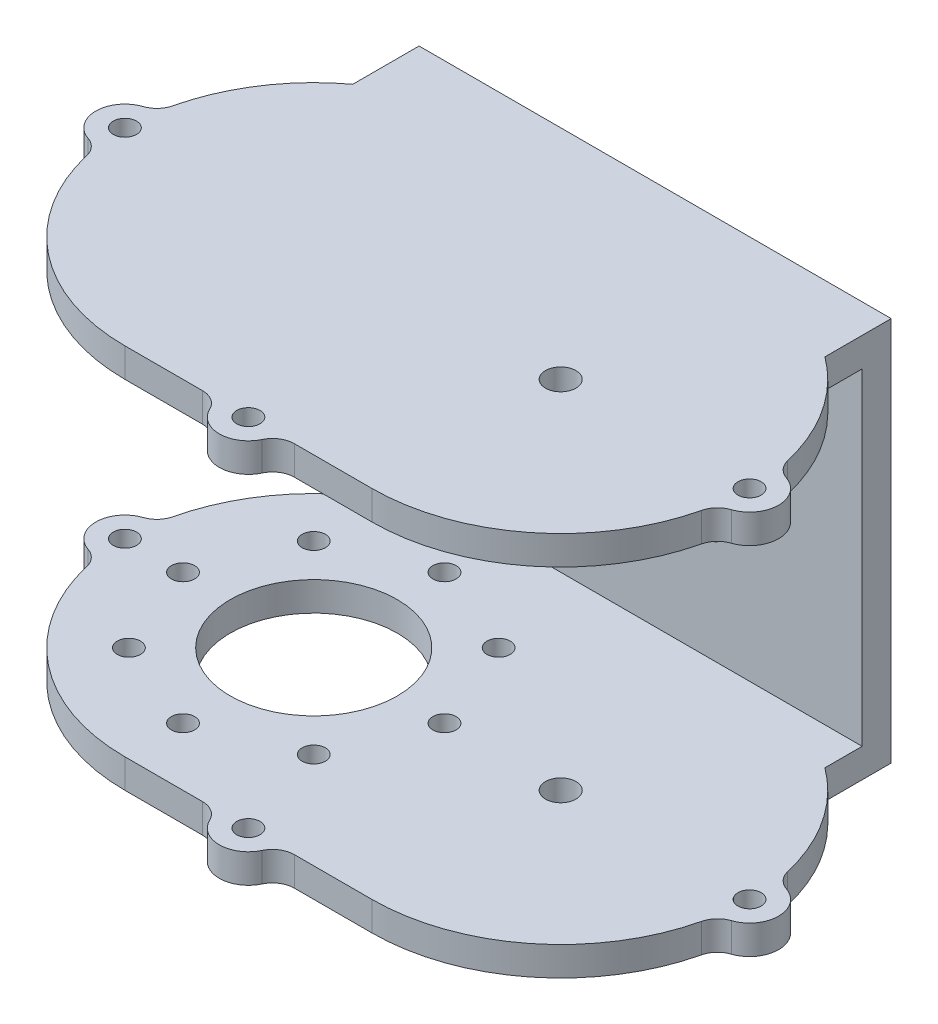
from build123d import *
from build123d.topology import SkipClean

# Parameters (mm, degrees)
SKETCH_1_W          = 65
SKETCH_1_H          = 53
SKETCH_1_R          = 1.6
EXTRUDE_1_DEPTH     = 4
EXTRUDE_2_DEPTH     = 60
SKETCH_5_R          = 1.6
SKETCH_5_R_2        = 11.5
CUT_EXTRUDE_1_DEPTH = 4
CUT_EXTRUDE_2_DEPTH = 69
SKETCH_6_3_R        = 1.6
EXTRUDE_3_DEPTH     = 4
EXTRUDE_START       = -53
EXTRUDE_4_DEPTH     = 4
SKETCH_7_R          = 2.1
CUT_EXTRUDE_3_DEPTH = 100
EXTRUDE_6_DEPTH     = 4
EXTRUDE_START_2     = -49
EXTRUDE_7_DEPTH     = 4
CUT_EXTRUDE_4_DEPTH = 70
FILLET_1_R          = 3


# Read off the part's stored shape, not the designer's step: 凸台-拉伸4
with BuildPart() as part:
    # 草图1 → 凸台-拉伸1 (new body)
    with BuildSketch(Plane.XY):
        Rectangle(SKETCH_1_W, SKETCH_1_H)
        with Locations((0, 13.5)):
            Circle(SKETCH_1_R, mode=Mode.SUBTRACT)
        with Locations((11.691342951, 6.75)):
            Circle(SKETCH_1_R, mode=Mode.SUBTRACT)
        with Locations((11.691342951, -6.75)):
            Circle(SKETCH_1_R, mode=Mode.SUBTRACT)
        with Locations((0, -13.5)):
            Circle(SKETCH_1_R, mode=Mode.SUBTRACT)
        with Locations((-11.691342951, -6.75)):
            Circle(SKETCH_1_R, mode=Mode.SUBTRACT)
        with Locations((-11.691342951, 6.75)):
            Circle(SKETCH_1_R, mode=Mode.SUBTRACT)
    extrude(amount=EXTRUDE_1_DEPTH)

    # 草图3 → 凸台-拉伸2 (add)
    with BuildSketch(Plane.XY.offset(4)):
        Polygon((28.5, 22.5), (-28.5, 22.5), (-32.5, 22.5), (-32.5, 26.5), (32.5, 26.5), (32.5, 22.5), align=None)
        Polygon((-28.5, -22.5), (28.5, -22.5), (32.5, -22.5), (32.5, -26.5), (-32.5, -26.5), (-32.5, -22.5), align=None)
    extrude(amount=EXTRUDE_2_DEPTH)

    # 草图5 → 切除-拉伸1 (cut)
    with BuildSketch(Plane.XZ.offset(26.5)):
        with Locations(Location((-17, 48, 0), (0, 0, 270))):
            Circle(SKETCH_5_R)
        with Locations(Location((-17, 30, 0), (0, 0, 270))):
            Circle(SKETCH_5_R_2)
        with Locations(Location((-4.272077939, 42.727922061, 0), (0, 0, 270))):
            Circle(SKETCH_5_R)
        with Locations(Location((1, 30, 0), (0, 0, 270))):
            Circle(SKETCH_5_R)
        with Locations(Location((-4.272077939, 17.272077939, 0), (0, 0, 270))):
            Circle(SKETCH_5_R)
        with Locations(Location((-17, 12, 0), (0, 0, 270))):
            Circle(SKETCH_5_R)
        with Locations(Location((-29.727922061, 17.272077939, 0), (0, 0, 270))):
            Circle(SKETCH_5_R)
        with Locations((-35, 30)):
            Circle(SKETCH_5_R)
        with Locations(Location((-29.727922061, 42.727922061, 0), (0, 0, 270))):
            Circle(SKETCH_5_R)
    extrude(amount=-CUT_EXTRUDE_1_DEPTH, mode=Mode.SUBTRACT)

    # 草图6 → 切除-拉伸2 (cut)
    with BuildSketch(Plane.XZ.offset(26.5)):
        with BuildLine():
            ThreePointArc((-32.5, 50.874625745), (-25.162711885, 54.685423527), (-17, 56))
            Line((-17, 56), (17, 56))
            ThreePointArc((17, 56), (25.162711885, 54.685423527), (32.5, 50.874625745))
            Line((32.5, 50.874625745), (32.5, 64))
            Line((32.5, 64), (-32.5, 64))
            Line((-32.5, 64), (-32.5, 50.874625745))
        make_face()
    extrude(amount=-CUT_EXTRUDE_2_DEPTH, mode=Mode.SUBTRACT)

    # 草图6<3> → 凸台-拉伸3 (add)
    # profile 1 of 2: a face of its own
    with BuildSketch(Plane.XZ.offset(26.5)):
        with BuildLine():
            Line((-32.5, 9.125374255), (-32.5, 50.874625745))
            ThreePointArc((-32.5, 50.874625745), (-43, 30), (-32.5, 9.125374255))
        make_face()
        with Locations(Location((-35, 30, 0), (0, 0, 270))):
            Circle(SKETCH_6_3_R, mode=Mode.SUBTRACT)
    # profile 2 of 2: a face of its own
    with BuildSketch(Plane.XZ.offset(26.5)):
        with BuildLine():
            ThreePointArc((32.5, 9.125374255), (43, 30), (32.5, 50.874625745))
            Line((32.5, 50.874625745), (32.5, 9.125374255))
        make_face()
    extrude(amount=-EXTRUDE_3_DEPTH)

    # 凸台-拉伸4 outline → 凸台-拉伸4 (add)
    with BuildSketch(Plane.XZ.offset(26.5).offset(EXTRUDE_START)):
        with BuildLine():
            Line((-32.5, 9.125374255), (-32.5, 50.874625745))
            ThreePointArc((-32.5, 50.874625745), (-43, 30), (-32.5, 9.125374255))
        make_face()
        with BuildLine():
            Line((32.5, 50.874625745), (32.5, 9.125374255))
            ThreePointArc((32.5, 9.125374255), (43, 30), (32.5, 50.874625745))
        make_face()
    extrude(amount=EXTRUDE_4_DEPTH)

    # 草图7 → 切除-拉伸3 (cut)
    with BuildSketch(Plane(origin=(0, 26.5, 0), x_dir=(1, 0, 0), z_dir=(0, 1, 0))):
        with Locations(Location((17, -30, 0), (0, 0, 270))):
            Circle(SKETCH_7_R)
    extrude(amount=-CUT_EXTRUDE_3_DEPTH, mode=Mode.SUBTRACT)

    # 草图8 → 凸台-拉伸6 (add)
    with BuildSketch(Plane.XZ.offset(26.5)):
        with BuildLine():
            ThreePointArc((4, 56), (0, 60), (-4, 56))
            Line((-4, 56), (-1.6, 56))
            ThreePointArc((-1.6, 56), (0, 57.6), (1.6, 56))
            Line((1.6, 56), (4, 56))
        make_face()
        with BuildLine():
            ThreePointArc((-42.950769231, 31.599242424), (-42.849150201, 32.796682655), (-42.692307692, 33.988148122))
            ThreePointArc((-42.692307692, 33.988148122), (-47, 30), (-42.692307692, 26.011851878))
            ThreePointArc((-42.692307692, 26.011851878), (-42.849150201, 27.203317345), (-42.950769231, 28.400757576))
            ThreePointArc((-42.950769231, 28.400757576), (-44.6, 30), (-42.950769231, 31.599242424))
        make_face()
        with BuildLine():
            ThreePointArc((42.692307692, 26.011851878), (47, 30), (42.692307692, 33.988148122))
            ThreePointArc((42.692307692, 33.988148122), (42.849150201, 32.796682655), (42.950769231, 31.599242424))
            ThreePointArc((42.950769231, 31.599242424), (44.113829154, 31.148644686), (44.6, 30))
            ThreePointArc((44.6, 30), (44.113829154, 28.851355314), (42.950769231, 28.400757576))
            ThreePointArc((42.950769231, 28.400757576), (42.849150201, 27.203317345), (42.692307692, 26.011851878))
        make_face()
    extrude(amount=-EXTRUDE_6_DEPTH)

    # 草图8<4> → 凸台-拉伸7 (add)
    with BuildSketch(Plane.XZ.offset(26.5).offset(EXTRUDE_START_2)):
        with BuildLine():
            ThreePointArc((4, 56), (0, 60), (-4, 56))
            Line((-4, 56), (-1.6, 56))
            ThreePointArc((-1.6, 56), (0, 57.6), (1.6, 56))
            Line((1.6, 56), (4, 56))
        make_face()
        with BuildLine():
            ThreePointArc((42.692307692, 26.011851878), (47, 30), (42.692307692, 33.988148122))
            ThreePointArc((42.692307692, 33.988148122), (42.849150201, 32.796682655), (42.950769231, 31.599242424))
            ThreePointArc((42.950769231, 31.599242424), (44.113829154, 31.148644686), (44.6, 30))
            ThreePointArc((44.6, 30), (44.113829154, 28.851355314), (42.950769231, 28.400757576))
            ThreePointArc((42.950769231, 28.400757576), (42.849150201, 27.203317345), (42.692307692, 26.011851878))
        make_face()
        with BuildLine():
            ThreePointArc((-42.950769231, 31.599242424), (-42.849150201, 32.796682655), (-42.692307692, 33.988148122))
            ThreePointArc((-42.692307692, 33.988148122), (-47, 30), (-42.692307692, 26.011851878))
            ThreePointArc((-42.692307692, 26.011851878), (-42.849150201, 27.203317345), (-42.950769231, 28.400757576))
            ThreePointArc((-42.950769231, 28.400757576), (-44.6, 30), (-42.950769231, 31.599242424))
        make_face()
    extrude(amount=-EXTRUDE_7_DEPTH)

    # 草图8<5> → 切除-拉伸4 (cut)
    with SkipClean():  # the faces are left unmerged after this step: merging them gives an invalid solid
        with BuildSketch(Plane.XZ.offset(26.5)):
            with BuildLine():
                Line((0, 56), (-1.6, 56))
                ThreePointArc((-1.6, 56), (-1.13137085, 54.86862915), (0, 54.4))
                Line((0, 54.4), (0, 56))
            make_face()
            with BuildLine():
                ThreePointArc((0, 54.4), (1.13137085, 54.86862915), (1.6, 56))
                Line((1.6, 56), (0, 56))
                Line((0, 56), (0, 54.4))
            make_face()
            with BuildLine():
                ThreePointArc((42.950769231, 28.400757576), (43, 30), (42.950769231, 31.599242424))
                ThreePointArc((42.950769231, 31.599242424), (41.4, 30), (42.950769231, 28.400757576))
            make_face()
            with BuildLine():
                ThreePointArc((44.6, 30), (44.113829154, 31.148644686), (42.950769231, 31.599242424))
                ThreePointArc((42.950769231, 31.599242424), (43, 30), (42.950769231, 28.400757576))
                ThreePointArc((42.950769231, 28.400757576), (44.113829154, 28.851355314), (44.6, 30))
            make_face()
            with BuildLine():
                ThreePointArc((-42.950769231, 28.400757576), (-43, 30), (-42.950769231, 31.599242424))
                ThreePointArc((-42.950769231, 31.599242424), (-44.6, 30), (-42.950769231, 28.400757576))
            make_face()
            with BuildLine():
                ThreePointArc((-41.4, 30), (-41.851355314, 31.113829154), (-42.950769231, 31.599242424))
                ThreePointArc((-42.950769231, 31.599242424), (-43, 30), (-42.950769231, 28.400757576))
                ThreePointArc((-42.950769231, 28.400757576), (-41.851355314, 28.886170846), (-41.4, 30))
            make_face()
        extrude(amount=-CUT_EXTRUDE_4_DEPTH, mode=Mode.SUBTRACT)

    # 圆角1
    fillet_1_edges = [part.edges().sort_by_distance(p)[0] for p in [
        (4, -24.5, 56),
        (-4, -24.5, 56),
        (-42.692307692, -24.5, 33.988148122),
        (-42.692307692, -24.5, 26.011851878),
        (42.692307692, -24.5, 26.011851878),
        (42.692307692, -24.5, 33.988148122),
        (-4, 24.5, 56),
        (4, 24.5, 56),
        (42.692307692, 24.5, 33.988148122),
        (42.692307692, 24.5, 26.011851878),
        (-42.692307692, 24.5, 26.011851878),
        (-42.692307692, 24.5, 33.988148122),
    ]]
    fillet(fillet_1_edges, radius=FILLET_1_R)


solid = part.part
